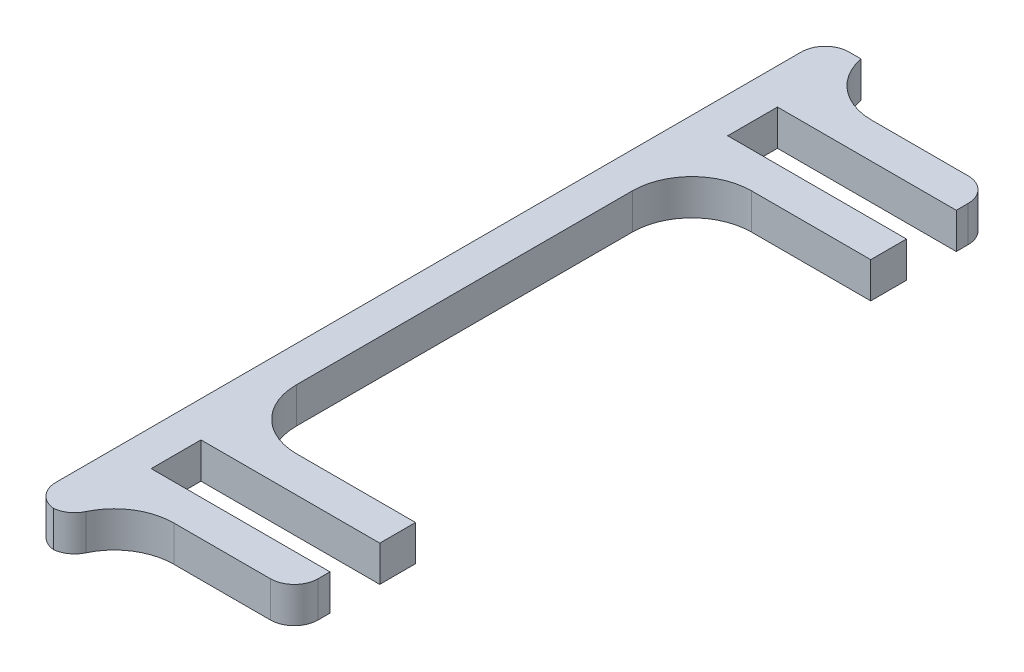
from build123d import *

# Parameters (mm, degrees)
BOSS_EXTRUDE1_DEPTH = 3
FILLET1_R           = 5
FILLET2_R           = 2


with BuildPart() as part:
    # Sketch2 → Boss-Extrude1 (new body)
    with BuildSketch(Plane(origin=(0, 0, 0), x_dir=(1, 0, 0), z_dir=(0, 1, 0))):
        Polygon((-128.893875, -24.675), (-143.893875, -24.675), (-143.893875, -20.5), (-128.893875, -20.5), (-128.893875, -17.5), (-143.893875, -17.5), (-143.893875, 20.69), (-128.893875, 20.69), (-128.893875, 23.69), (-143.893875, 23.69), (-143.893875, 27.865), (-128.893875, 27.865), (-128.893875, 30.865), (-143.893875, 30.865), (-143.893875, 34.865), (-146.893875, 34.865), (-146.893875, -31.675), (-143.893875, -31.675), (-143.893875, -27.675), (-128.893875, -27.675), align=None)
    extrude(amount=BOSS_EXTRUDE1_DEPTH)

    # Fillet1
    # the kernel refuses this fillet: 5 mm, written as the material it adds along each edge
    with BuildSketch(Plane(origin=(-143.893875, 0, 27.675), x_dir=(1.4566126083077746e-12, 0, 1.0), z_dir=(0, 1, 0))) as fillet1_piece_1:
        with BuildLine():
            CenterArc((5, 4.898979486), FILLET1_R, 180, 78.463040967)
            Line((0, 4.898979486), (-0.1, 4.898979486))
            Line((-0.1, 4.898979486), (-0.1, 0))
            Line((-0.1, 0), (0, -0.1))
            ThreePointArc((0, -0.1), (2, -0.1), (3.98, -0.09797959))
            Line((3.98, -0.09797959), (4, 0))
        make_face()
    extrude(amount=3)
    with BuildSketch(Plane(origin=(-143.893875, 0, -30.865), x_dir=(1, 0, 0), z_dir=(0, 1, 0))) as fillet1_piece_2:
        with BuildLine():
            CenterArc((4.898979486, 5), FILLET1_R, 191.536959033, 78.463040967)
            Line((0, 4), (-0.09797959, 3.98))
            ThreePointArc((-0.09797959, 3.98), (-0.1, 2), (-0.1, 0))
            Line((-0.1, 0), (0, -0.1))
            Line((0, -0.1), (4.898979486, -0.1))
            Line((4.898979486, -0.1), (4.898979486, 0))
        make_face()
    extrude(amount=3)
    with BuildSketch(Plane(origin=(-143.893875, 0, -20.69), x_dir=(0, 0, 1), z_dir=(0, 1, 0)), Plane(origin=(-143.893875, 0, 17.5), x_dir=(1, 0, 0), z_dir=(0, 1, 0))) as fillet1_piece_3:
        with BuildLine():
            CenterArc((FILLET1_R, FILLET1_R), FILLET1_R, 180, 90)
            Line((0, FILLET1_R), (-FILLET1_R * 0.02, FILLET1_R))
            Line((-FILLET1_R * 0.02, FILLET1_R), (-FILLET1_R * 0.02, -FILLET1_R * 0.02))
            Line((-FILLET1_R * 0.02, -FILLET1_R * 0.02), (FILLET1_R, -FILLET1_R * 0.02))
            Line((FILLET1_R, -FILLET1_R * 0.02), (FILLET1_R, 0))
        make_face()
    extrude(amount=3)

    # Fillet2
    # the kernel refuses this fillet: 2 mm, written as the material it takes off along each edge
    with BuildSketch(Plane(origin=(-128.893875, -5, 27.675), x_dir=(-1, 0, 0), z_dir=(0, 1, 0)), Plane(origin=(-128.893875, -5, -30.865), x_dir=(0, 0, 1), z_dir=(0, 1, 0)), Plane(origin=(-146.893875, -5, -34.865), x_dir=(1, 0, 0), z_dir=(0, 1, 0)), Plane(origin=(-146.893875, -5, 31.675), x_dir=(0, 0, -1), z_dir=(0, 1, 0))) as fillet2_piece_1:
        with BuildLine():
            CenterArc((FILLET2_R, -FILLET2_R), FILLET2_R, 90, 90)
            Line((0, -FILLET2_R), (0, 0))
            Line((0, 0), (FILLET2_R, 0))
        make_face()
    extrude(amount=13, mode=Mode.SUBTRACT)
    with BuildSketch(Plane(origin=(-143.893875, -3.563939587, 31.675), x_dir=(-1, 0, 0), z_dir=(0, 1, 0))) as fillet2_piece_2:
        with BuildLine():
            CenterArc((1.425575835, -2), FILLET2_R, 90, 64.623066475)
            ThreePointArc((-0.381439971, -1.142857143), (-0.156170388, -0.582959844), (0, 0))
            Line((0, 0), (1.425575835, 0))
        make_face()
    extrude(amount=10.127879174, mode=Mode.SUBTRACT)


solid = part.part
